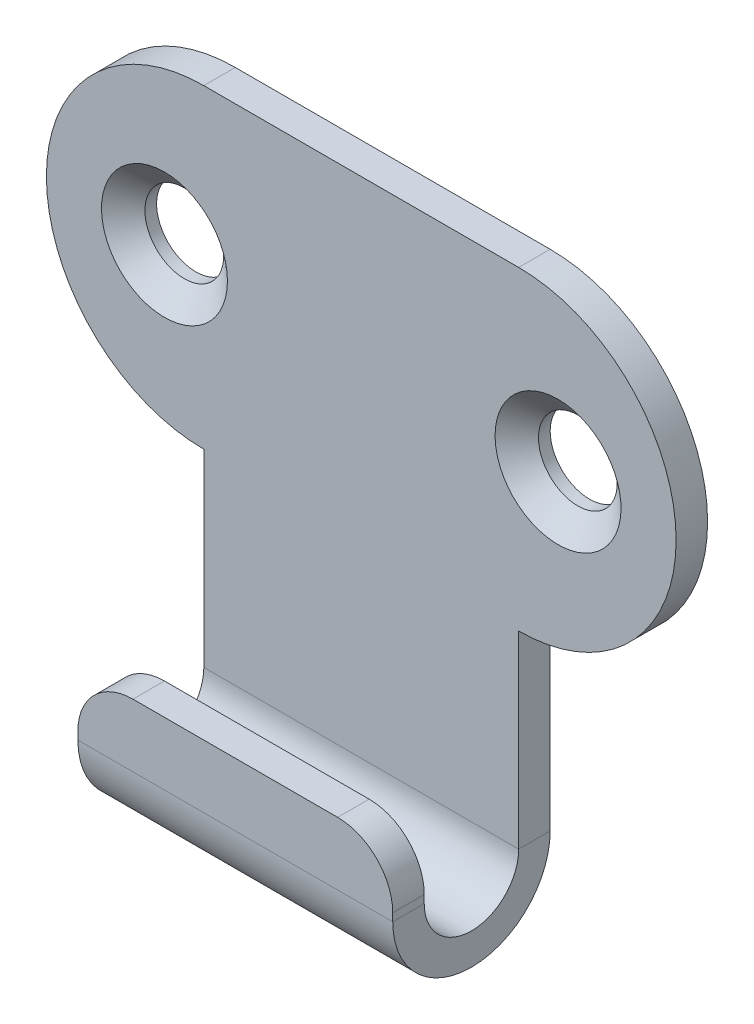
from build123d import *

# Parameters (mm, degrees)
T_LE_DE_BASE_PLI_E1_DEPTH = 10
PATTE1_DEPTH              = 2
ESQUISSE9_R               = 2.5
ENL_V_MAT_EXTRU_1_DEPTH   = 35.539832078
CHANFREIN1_SIZE           = 1.5
CHANFREIN1_SIZE2          = 1.258649447
CONG_1_R                  = 3.5


# Sheet-metal steps are written as plain solids
with BuildPart() as part:
    # Esquisse1 → Tôle de base pliée1 (new, symmetric)
    with BuildSketch(Plane(origin=(0, 0, 0), x_dir=(0, 0, -1), z_dir=(1, 0, 0))):
        with BuildLine():
            Line((0, 10), (0, -22))
            ThreePointArc((0, -22), (-5, -27), (-10, -22))
            Line((-10, -22), (-10, -18))
            Line((-10, -18), (-8, -18))
            Line((-8, -18), (-8, -22))
            ThreePointArc((-8, -22), (-5, -25), (-2, -22))
            Line((-2, -22), (-2, 10))
            Line((-2, 10), (0, 10))
        make_face()
    extrude(amount=T_LE_DE_BASE_PLI_E1_DEPTH, both=True)

    # Esquisse6 → Patte1 (add)
    with BuildSketch(Plane.XY.offset(2)):
        with BuildLine():
            Line((-10, 10), (10, 10))
            ThreePointArc((10, 10), (20, 0), (10, -10))
            Line((10, -10), (-10, -10))
            ThreePointArc((-10, -10), (-20, 0), (-10, 10))
        make_face()
    extrude(amount=-PATTE1_DEPTH)

    # Esquisse9 → Enlèv. mat.-Extru.1 (cut, through all)
    with BuildSketch(Plane.XY.offset(2)):
        with Locations((-12.5, 0)):
            Circle(ESQUISSE9_R)
        with Locations(Location((12.5, 0, 0), (0, 0, 180))):
            Circle(ESQUISSE9_R)
    extrude(amount=-ENL_V_MAT_EXTRU_1_DEPTH, mode=Mode.SUBTRACT)

    # Chanfrein1
    chanfrein1_edges = [part.edges().sort_by_distance(p)[0] for p in [
        (-15, 0, 2),
        (15, 0, 2),
    ]]
    chanfrein1_side = [part.faces().sort_by_distance(p)[0] for p in [
        (0, -4.197228845, 2),
    ]]
    chamfer(chanfrein1_edges, length=CHANFREIN1_SIZE, length2=CHANFREIN1_SIZE2, reference=chanfrein1_side[0])

    # Congé1
    cong_1_edges = [part.edges().sort_by_distance(p)[0] for p in [
        (10, -18, 9),
        (-10, -18, 9),
    ]]
    fillet(cong_1_edges, radius=CONG_1_R)


solid = part.part
